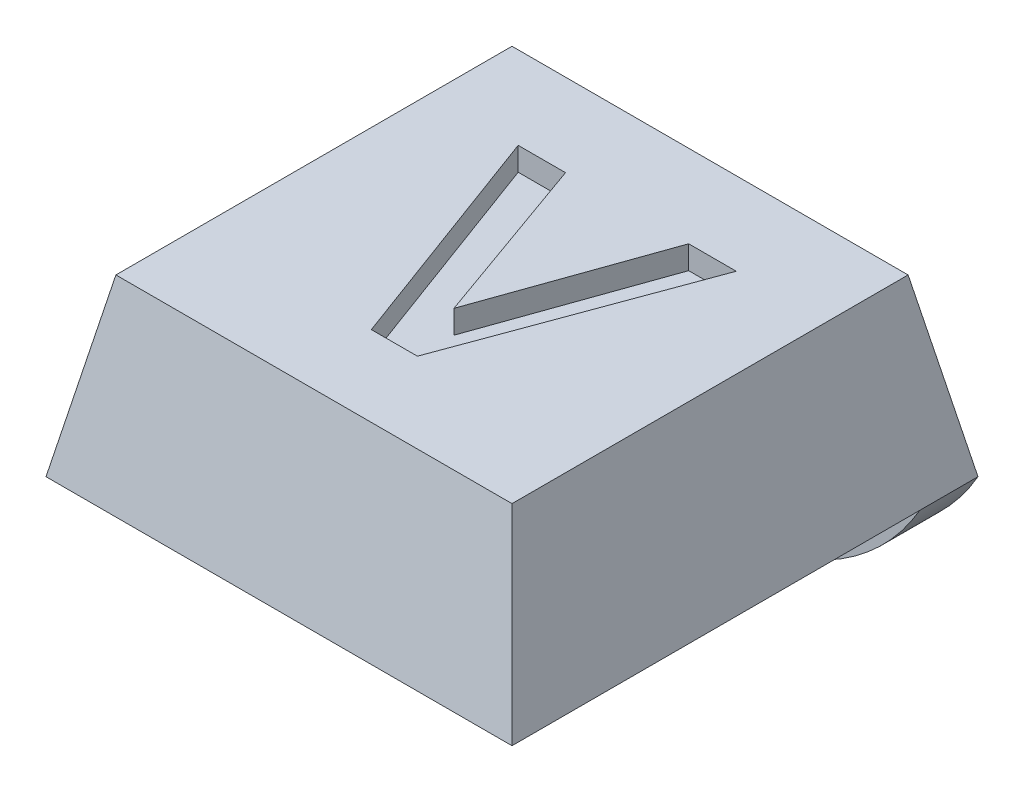
from build123d import *

# Parameters (mm, degrees)
SKETCH1_W               = 8
SKETCH1_H               = 8
BOSS_EXTRUDE1_DEPTH     = 3
CUT_EXTRUDE1_DEPTH      = 12.704699911
CUT_EXTRUDE1_DEPTH_BACK = 12.704699911
CUT_EXTRUDE2_DEPTH      = 11
SKETCH4_R               = 1.8
CUT_EXTRUDE3_DEPTH      = 0.8
SKETCH5_W               = 8
SKETCH5_H               = 1
BOSS_EXTRUDE2_DEPTH     = 2
FILLET1_R               = 4
CUT_EXTRUDE4_DEPTH      = 0.4


with BuildPart() as part:
    # Sketch1 → Boss-Extrude1 (new body)
    with BuildSketch(Plane(origin=(0, 0, 0), x_dir=(1, 0, 0), z_dir=(0, 1, 0))):
        with Locations((4, 4)):
            Rectangle(SKETCH1_W, SKETCH1_H)
    extrude(amount=BOSS_EXTRUDE1_DEPTH)

    # Sketch2 → Cut-Extrude1 (cut, two sides: drawn at the far end of the back side and taken through both)
    with BuildSketch(Plane.XY.offset(-CUT_EXTRUDE1_DEPTH_BACK)):
        Polygon((0, 0), (0.6, 3), (0, 3), align=None)
        Polygon((8, 0), (7.4, 3), (8, 3), align=None)
    extrude(amount=CUT_EXTRUDE1_DEPTH + CUT_EXTRUDE1_DEPTH_BACK, mode=Mode.SUBTRACT)

    # Sketch3 → Cut-Extrude2 (cut)
    with BuildSketch(Plane(origin=(0, 0, 0), x_dir=(0, 0, -1), z_dir=(1, 0, 0))):
        Polygon((0, 0), (0.6, 3), (0, 3), align=None)
        Polygon((8, 3), (7.4, 3), (8, 0), align=None)
    extrude(amount=CUT_EXTRUDE2_DEPTH, mode=Mode.SUBTRACT)

    # Sketch4 → Cut-Extrude3 (cut)
    with BuildSketch(Plane.XZ):
        with Locations(Location((4, -3.75, 0), (0, 0, 270))):
            Circle(SKETCH4_R)
    extrude(amount=-CUT_EXTRUDE3_DEPTH, mode=Mode.SUBTRACT)

    # Sketch5 → Boss-Extrude2 (add)
    with BuildSketch(Plane.XZ):
        with Locations((4, -7.5)):
            Rectangle(SKETCH5_W, SKETCH5_H)
    extrude(amount=BOSS_EXTRUDE2_DEPTH)

    # Fillet1
    # the kernel refuses this fillet: 4 mm, written as the material it takes off along each edge
    with BuildSketch(Plane(origin=(8, -2, -16.660254038), x_dir=(0, 1, 0), z_dir=(0, 0, 1)), Plane(origin=(0, -2, 1.660254038), x_dir=(0, 1, 0), z_dir=(0, 0, -1))) as fillet1_piece_1:
        with BuildLine():
            CenterArc((4, 3.464101615), FILLET1_R, 180, 60)
            Line((0, 3.464101615), (-0.08, 3.464101615))
            Line((-0.08, 3.464101615), (-0.08, 0))
            Line((-0.08, 0), (0, -0.08))
            ThreePointArc((0, -0.08), (1, -0.08), (1.96, -0.069282032))
            Line((1.96, -0.069282032), (2, 0))
        make_face()
    extrude(amount=18.320508076, mode=Mode.SUBTRACT)

    # Sketch6 → Cut-Extrude4 (cut)
    with BuildSketch(Plane(origin=(0, 3, 0), x_dir=(1, 0, 0), z_dir=(0, 1, 0))):
        Polygon((3.605424489, 1.979723732), (2.126257822, 5.979723732), (2.938757822, 5.979723732), (3.998052694, 3.005364758), (5.053341155, 5.979723732), (5.869847566, 5.979723732), (4.396289873, 1.979723732), align=None)
    extrude(amount=-CUT_EXTRUDE4_DEPTH, mode=Mode.SUBTRACT)


solid = part.part
